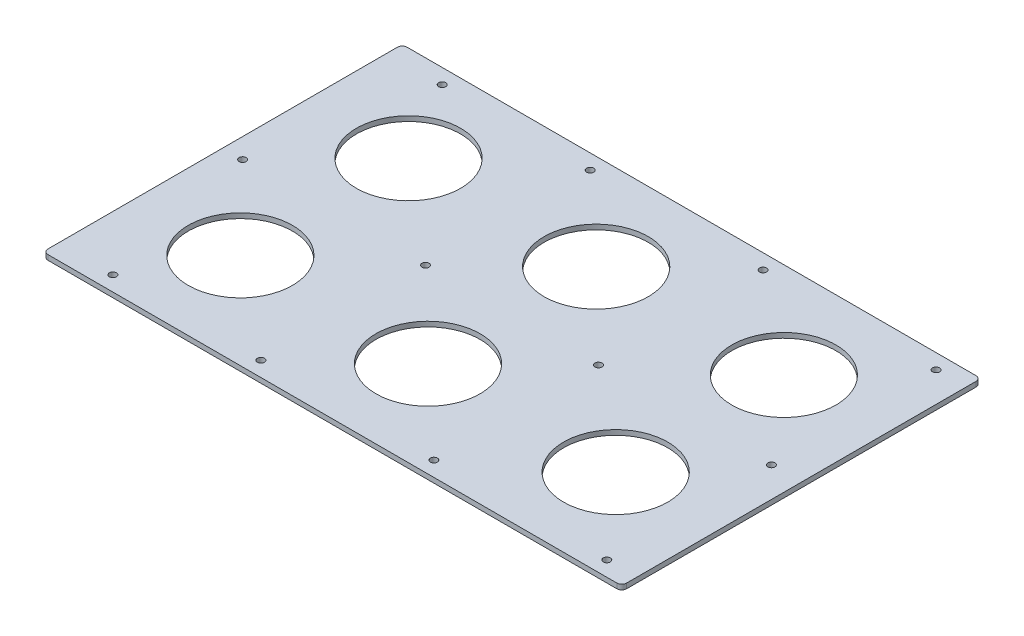
from build123d import *

# Parameters (mm, degrees)
SKETCH1_R           = 33.147
SKETCH1_R_2         = 2.2479
BOSS_EXTRUDE1_DEPTH = 3.175


with BuildPart() as part:
    # Sketch1 → Boss-Extrude1 (new body)
    with BuildSketch(Plane(origin=(0, 0, 0), x_dir=(1, 0, 0), z_dir=(0, 1, 0))):
        with BuildLine():
            Line((-180.975, 114.3), (180.975, 114.3))
            ThreePointArc((180.975, 114.3), (183.22006403, 113.37006403), (184.15, 111.125))
            Line((184.15, 111.125), (184.15, -111.125))
            ThreePointArc((184.15, -111.125), (183.22006403, -113.37006403), (180.975, -114.3))
            Line((180.975, -114.3), (-180.975, -114.3))
            ThreePointArc((-180.975, -114.3), (-183.22006403, -113.37006403), (-184.15, -111.125))
            Line((-184.15, -111.125), (-184.15, 111.125))
            ThreePointArc((-184.15, 111.125), (-183.22006403, 113.37006403), (-180.975, 114.3))
        make_face()
        with Locations((119.508581684, -53.5178)):
            Circle(SKETCH1_R, mode=Mode.SUBTRACT)
        with Locations((165.1, 0)):
            Circle(SKETCH1_R_2, mode=Mode.SUBTRACT)
        with Locations((-171.45, 0)):
            Circle(SKETCH1_R_2, mode=Mode.SUBTRACT)
        with Locations((-55.033333333, 0)):
            Circle(SKETCH1_R_2, mode=Mode.SUBTRACT)
        with Locations((55.033333333, 0)):
            Circle(SKETCH1_R_2, mode=Mode.SUBTRACT)
        with Locations((119.508581684, 53.5178)):
            Circle(SKETCH1_R, mode=Mode.SUBTRACT)
        with Locations((0.064290842, 53.5178)):
            Circle(SKETCH1_R, mode=Mode.SUBTRACT)
        with Locations((0.064290842, -53.5178)):
            Circle(SKETCH1_R, mode=Mode.SUBTRACT)
        with Locations((-119.38, 53.5178)):
            Circle(SKETCH1_R, mode=Mode.SUBTRACT)
        with Locations((-119.38, -53.5178)):
            Circle(SKETCH1_R, mode=Mode.SUBTRACT)
        with Locations((-149.225, -104.775)):
            Circle(SKETCH1_R_2, mode=Mode.SUBTRACT)
        with Locations((-55.033333333, -104.775)):
            Circle(SKETCH1_R_2, mode=Mode.SUBTRACT)
        with Locations((55.033333333, -104.775)):
            Circle(SKETCH1_R_2, mode=Mode.SUBTRACT)
        with Locations((165.1, -104.775)):
            Circle(SKETCH1_R_2, mode=Mode.SUBTRACT)
        with Locations((-149.225, 104.775)):
            Circle(SKETCH1_R_2, mode=Mode.SUBTRACT)
        with Locations((-55.033333333, 104.775)):
            Circle(SKETCH1_R_2, mode=Mode.SUBTRACT)
        with Locations((55.033333333, 104.775)):
            Circle(SKETCH1_R_2, mode=Mode.SUBTRACT)
        with Locations((165.1, 104.775)):
            Circle(SKETCH1_R_2, mode=Mode.SUBTRACT)
    extrude(amount=BOSS_EXTRUDE1_DEPTH)


solid = part.part
